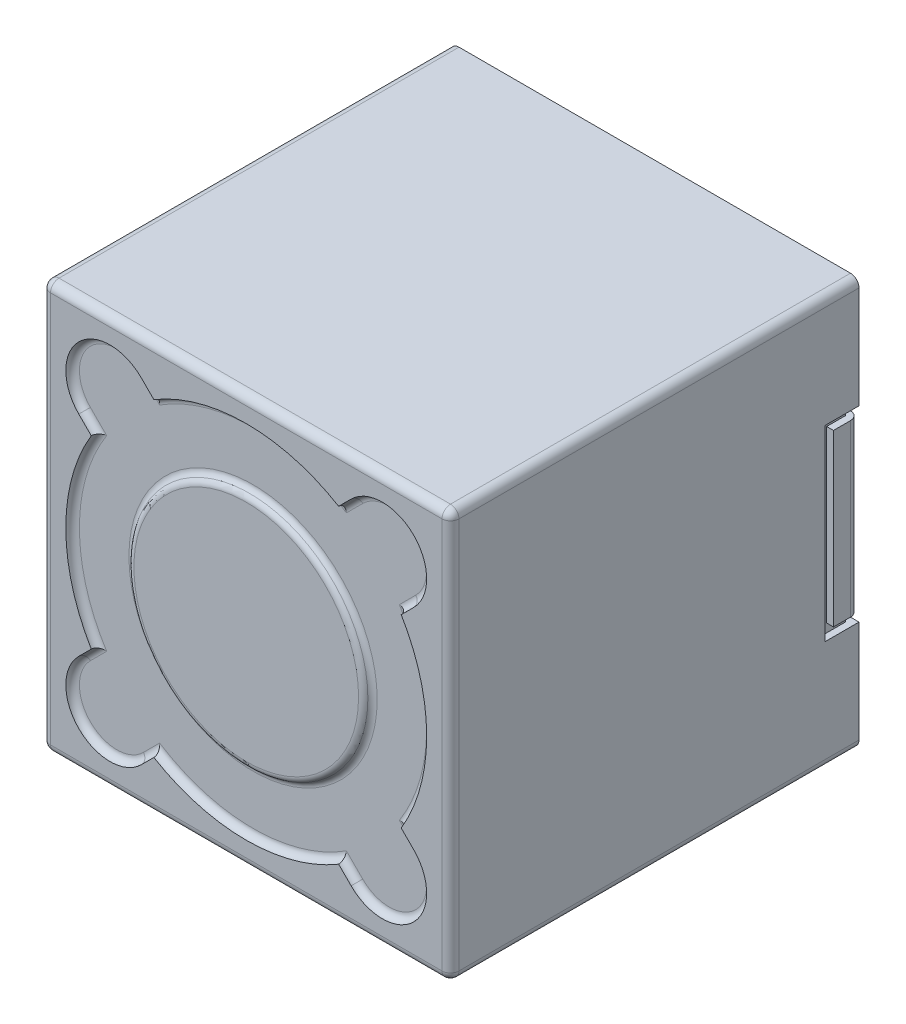
from build123d import *

# Parameters (mm, degrees)
SKETCH2_W           = 12
SKETCH2_H           = 12
BOSS_EXTRUDE1_DEPTH = 12
SKETCH3_W           = 2.55
SKETCH3_H           = 5.5
CUT_EXTRUDE1_DEPTH  = 0.2
SKETCH4_W           = 0.8
SKETCH4_H           = 5.5
CUT_EXTRUDE2_DEPTH  = 0.2
FILLET1_R           = 0.25
SKETCH5_W           = 2.3
SKETCH5_H           = 5
BOSS_EXTRUDE2_DEPTH = 0.75
FILLET2_R           = 0.25
SKETCH6_R           = 3.5
CUT_EXTRUDE3_DEPTH  = 0.2
FILLET3_R           = 0.2
FILLET4_R           = 0.2


with BuildPart() as part:
    # Sketch2 → Boss-Extrude1 (new body)
    with BuildSketch(Plane.XY):
        Rectangle(SKETCH2_W, SKETCH2_H)
    extrude(amount=BOSS_EXTRUDE1_DEPTH)

    # Sketch3 → Cut-Extrude1 (cut)
    with BuildSketch(Plane(origin=(0, 0, 0), x_dir=(-1, 0, 0), z_dir=(0, 0, -1))):
        with Locations((-4.725, 0)):
            Rectangle(SKETCH3_W, SKETCH3_H)
        with Locations((4.725, 0)):
            Rectangle(SKETCH3_W, SKETCH3_H)
    extrude(amount=-CUT_EXTRUDE1_DEPTH, mode=Mode.SUBTRACT)

    # Sketch4 → Cut-Extrude2 (cut)
    with BuildSketch(Plane(origin=(6, 0, 0), x_dir=(0, 0, -1), z_dir=(1, 0, 0))):
        with Locations((-0.6, 0)):
            Rectangle(SKETCH4_W, SKETCH4_H)
    cut_extrude2 = extrude(amount=-CUT_EXTRUDE2_DEPTH, mode=Mode.SUBTRACT)

    # Mirror1: Cut-Extrude2 across plane
    add(cut_extrude2.mirror(Plane(origin=(0, 0, 0), x_dir=(0, 0, 1), z_dir=(1, 0, 0))), mode=Mode.SUBTRACT)

    # Fillet1
    fillet1_edges = [part.edges().sort_by_distance(p)[0] for p in [
        (6, 0, 12),
        (0, 6, 12),
        (-6, 0, 12),
        (0, -6, 12),
        (-6, 6, 6),
        (6, 6, 6),
        (6, -6, 6),
        (-6, -6, 6),
    ]]
    fillet(fillet1_edges, radius=FILLET1_R)

    # Sketch5 → Boss-Extrude2 (add)
    with BuildSketch(Plane(origin=(0, 0, 0), x_dir=(-1, 0, 0), z_dir=(0, 0, -1))):
        with Locations((-4.85, 0)):
            Rectangle(SKETCH5_W, SKETCH5_H)
        with Locations((4.85, 0)):
            Rectangle(SKETCH5_W, SKETCH5_H)
    extrude(amount=-BOSS_EXTRUDE2_DEPTH)

    # Fillet2
    fillet2_edges = [part.edges().sort_by_distance(p)[0] for p in [
        (6, 0, 0),
        (-6, 0, 0),
    ]]
    fillet(fillet2_edges, radius=FILLET2_R)

    # Sketch6 → Cut-Extrude3 (cut)
    with BuildSketch(Plane.XY.offset(12)):
        with BuildLine():
            Line((3.080761184, -4.919238816), (2.713941609, -4.55241924))
            ThreePointArc((2.713941609, -4.55241924), (0, -5.3), (-2.713941609, -4.55241924))
            Line((-2.713941609, -4.55241924), (-3.080761184, -4.919238816))
            ThreePointArc((-3.080761184, -4.919238816), (-4.919238816, -4.919238816), (-4.919238816, -3.080761184))
            Line((-4.919238816, -3.080761184), (-4.55241924, -2.713941609))
            ThreePointArc((-4.55241924, -2.713941609), (-5.3, 0), (-4.55241924, 2.713941609))
            Line((-4.55241924, 2.713941609), (-4.919238816, 3.080761184))
            ThreePointArc((-4.919238816, 3.080761184), (-4.919238816, 4.919238816), (-3.080761184, 4.919238816))
            Line((-3.080761184, 4.919238816), (-2.713941609, 4.55241924))
            ThreePointArc((-2.713941609, 4.55241924), (0, 5.3), (2.713941609, 4.55241924))
            Line((2.713941609, 4.55241924), (3.080761184, 4.919238816))
            ThreePointArc((3.080761184, 4.919238816), (4.919238816, 4.919238816), (4.919238816, 3.080761184))
            Line((4.919238816, 3.080761184), (4.55241924, 2.713941609))
            ThreePointArc((4.55241924, 2.713941609), (5.3, 0), (4.55241924, -2.713941609))
            Line((4.55241924, -2.713941609), (4.919238816, -3.080761184))
            ThreePointArc((4.919238816, -3.080761184), (4.919238816, -4.919238816), (3.080761184, -4.919238816))
        make_face()
        Circle(SKETCH6_R, mode=Mode.SUBTRACT)
    extrude(amount=-CUT_EXTRUDE3_DEPTH, mode=Mode.SUBTRACT)

    # Fillet3
    fillet3_edges = [part.edges().sort_by_distance(p)[0] for p in [
        (-3.5, 0, 12),
    ]]
    fillet(fillet3_edges, radius=FILLET3_R - 0.0001)  # a hair under: the kernel refuses the full size

    # Fillet4
    fillet4_edges = [part.edges().sort_by_distance(p)[0] for p in [
        (2.897351397, -4.735829028, 11.8),
        (0, -5.3, 11.8),
        (-2.897351397, -4.735829028, 11.8),
        (-4.919238816, -4.919238816, 11.8),
        (-4.735829028, -2.897351397, 11.8),
        (-5.3, 0, 11.8),
        (-4.735829028, 2.897351397, 11.8),
        (-4.919238816, 4.919238816, 11.8),
        (-2.897351397, 4.735829028, 11.8),
        (0, 5.3, 11.8),
        (2.897351397, 4.735829028, 11.8),
        (4.919238816, 4.919238816, 11.8),
        (4.735829028, 2.897351397, 11.8),
        (5.3, 0, 11.8),
        (4.735829028, -2.897351397, 11.8),
        (4.919238816, -4.919238816, 11.8),
        (-3.5, 0, 11.8),
    ]]
    fillet(fillet4_edges, radius=FILLET4_R - 0.0001)  # a hair under: the kernel refuses the full size


solid = part.part
